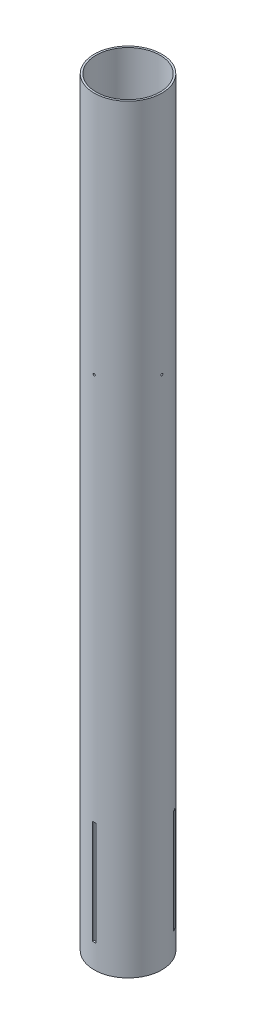
from build123d import *

# Parameters (mm, degrees)
SKETCH1_R                 = 53.721
SKETCH1_R_2               = 50.8
BODY_TUBE_EXTRUSION_DEPTH = 1206.5
ENGINE_BLOCK_HOLE_REACH   = 1214.465
SKETCH2_R                 = 1.6383
CIRPATTERN1_COUNT         = 4
SKETCH3_W                 = 5.334
SKETCH3_H                 = 165.1
FIN_TAB_SLOTS_DEPTH       = 2.54
CIRPATTERN2_COUNT         = 3


with BuildPart() as part:
    # Sketch1 → Body Tube Extrusion (new body)
    with BuildSketch(Plane(origin=(0, 0, 0), x_dir=(1, 0, 0), z_dir=(0, 1, 0))):
        Circle(SKETCH1_R)
        Circle(SKETCH1_R_2, mode=Mode.SUBTRACT)
    extrude(amount=BODY_TUBE_EXTRUSION_DEPTH)

    # Sketch2 → Engine Block Hole (cut, up to next)
    with BuildSketch(Plane.XY.offset(53.721), mode=Mode.PRIVATE) as engine_block_hole_sk1:
        with Locations((0, 819.15)):
            Circle(SKETCH2_R)
    engine_block_hole_tool1 = extrude(engine_block_hole_sk1.sketch, amount=-ENGINE_BLOCK_HOLE_REACH, mode=Mode.PRIVATE) & part.part
    engine_block_hole = engine_block_hole_tool1.solids().sort_by_distance((0, 819.15, 53.721))[0]
    add(engine_block_hole, mode=Mode.SUBTRACT)

    # CirPattern1: Engine Block Hole ×4 about axis
    cirpattern1_axis = Axis((0, 1206.5, 0), (0, -1, 0))
    for i in range(1, CIRPATTERN1_COUNT):
        add(engine_block_hole.rotate(cirpattern1_axis, i * 360 / CIRPATTERN1_COUNT), mode=Mode.SUBTRACT)

    # Sketch3 → Fin Tab Slots (cut)
    with BuildSketch(Plane.XY.offset(53.721)):
        with Locations((0, 120.65)):
            Rectangle(SKETCH3_W, SKETCH3_H)
    fin_tab_slots = extrude(amount=-FIN_TAB_SLOTS_DEPTH, mode=Mode.SUBTRACT)

    # CirPattern2: Fin Tab Slots ×3 about axis
    cirpattern2_axis = Axis((0, 1206.5, 0), (0, -1, 0))
    for i in range(1, CIRPATTERN2_COUNT):
        add(fin_tab_slots.rotate(cirpattern2_axis, i * 360 / CIRPATTERN2_COUNT), mode=Mode.SUBTRACT)


solid = part.part
